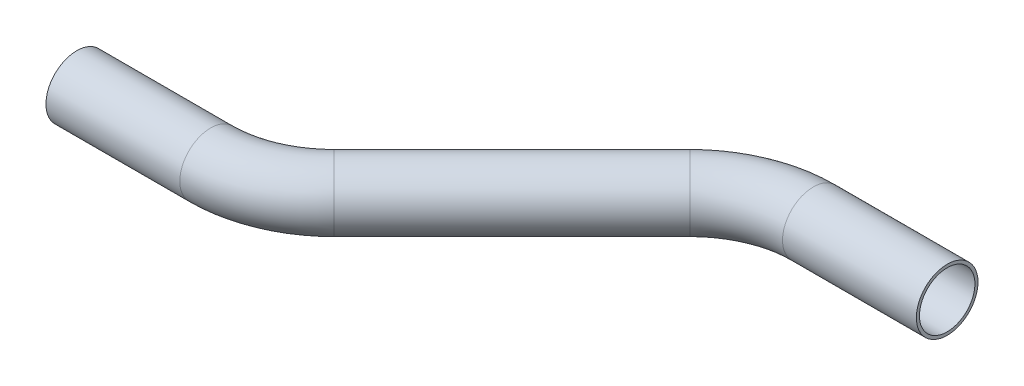
from build123d import *

# Parameters (mm, degrees)
SKETCH3_R   = 6.35
SKETCH3_R_2 = 5.715


with BuildPart() as part:
    # Sweep1: sweep along a path in Sketch2
    with BuildLine(Plane(origin=(0, 0, 0), x_dir=(1, 0, 0), z_dir=(0, 1, 0))) as sweep1_path:
        Line((0, 0), (27.578975516, 0))
        ThreePointArc((27.578975516, 0), (37.299134698, 1.933459874), (45.539487758, 7.439487758))
        Line((45.539487758, 7.439487758), (82.222512242, 44.122512242))
        ThreePointArc((82.222512242, 44.122512242), (90.462865302, 49.628540126), (100.183024484, 51.562))
        Line((100.183024484, 51.562), (127.762, 51.562))
    # Sketch3 → Sweep1 (sweep)
    with BuildSketch(Plane(origin=(0, 0, 0), x_dir=(0, 0, -1), z_dir=(1, 0, 0))):
        Circle(SKETCH3_R)
        Circle(SKETCH3_R_2, mode=Mode.SUBTRACT)
    sweep(path=sweep1_path.line)


solid = part.part
